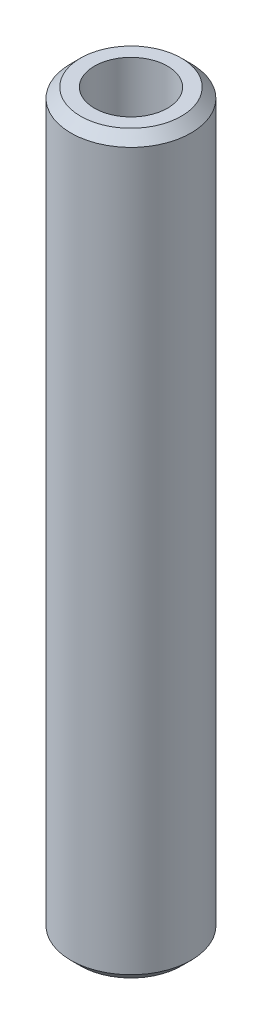
from build123d import *

# Parameters (mm, degrees)
SKETCH1_R           = 35
BOSS_EXTRUDE1_DEPTH = 428.61448166
SKETCH2_R           = 21.277876984
CUT_EXTRUDE1_DEPTH  = 432.463062021
CHAMFER1_SIZE       = 5.651484225


with BuildPart() as part:
    # Sketch1 → Boss-Extrude1 (new body)
    with BuildSketch(Plane(origin=(0, 0, 0), x_dir=(1, 0, 0), z_dir=(0, 1, 0))):
        Circle(SKETCH1_R)
    extrude(amount=BOSS_EXTRUDE1_DEPTH)

    # Sketch2 → Cut-Extrude1 (cut, through all)
    with BuildSketch(Plane(origin=(0, 0, 0), x_dir=(1, 0, 0), z_dir=(0, 1, 0))):
        Circle(SKETCH2_R)
    extrude(amount=CUT_EXTRUDE1_DEPTH, mode=Mode.SUBTRACT)

    # Chamfer1
    chamfer1_edges = [part.edges().sort_by_distance(p)[0] for p in [
        (-35, 428.61448166, 0),
        (-35, 0, 0),
    ]]
    chamfer(chamfer1_edges, length=CHAMFER1_SIZE)


solid = part.part
